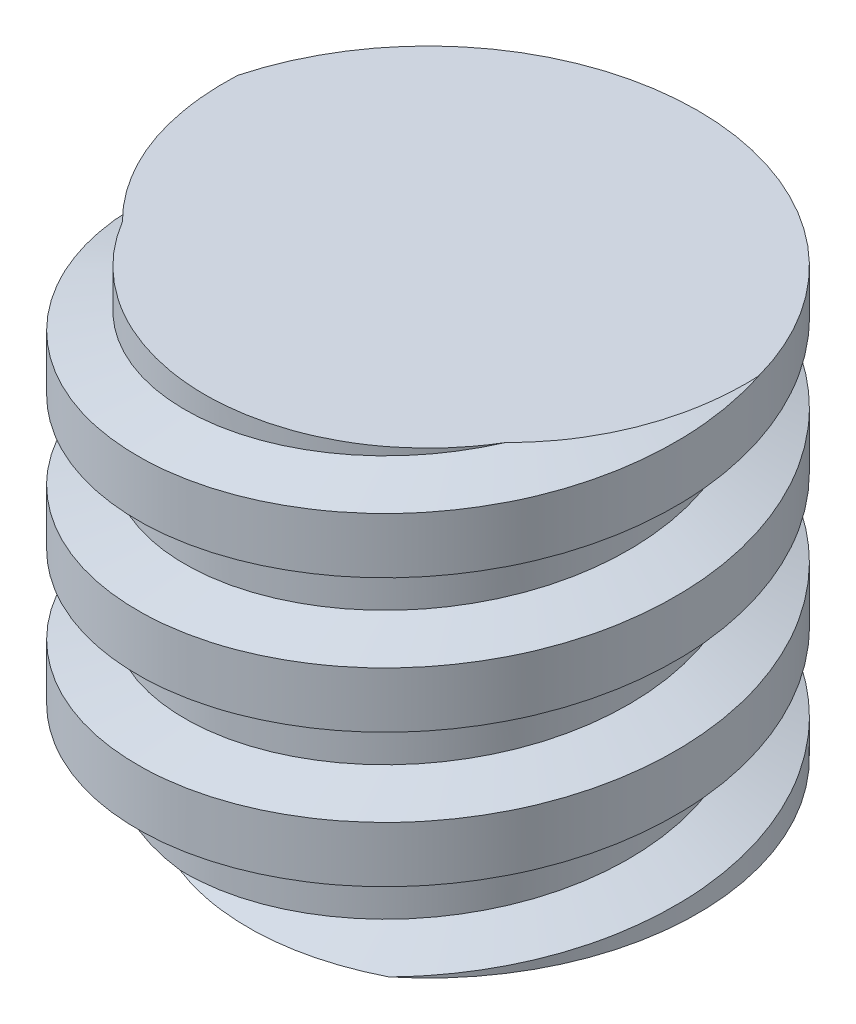
from build123d import *

# Parameters (mm, degrees)
SKETCH_3_W    = 9.5
SKETCH_3_H    = 15
SWEEP_1_PITCH = 4.712


with BuildPart() as part:
    # Эскиз3 → Повернуть1 (revolve)
    with BuildSketch(Plane.XY, mode=Mode.PRIVATE) as revolve_1_sk:
        with Locations((4.75, 7.5)):
            Rectangle(SKETCH_3_W, SKETCH_3_H)
    revolve(revolve_1_sk.sketch.rotate(Axis((0, 0, 0), (0, 1, 0)), 90), axis=Axis((0, 0, 0), (0, 1, 0)))

    # Вырез-По траектории1: arcs per turn and ends read off the stored shape
    # Вырез-По траектории1: the profile of Эскиз7 screwed along a right-hand helix through 8.75 turns, 12 arcs to a turn; built about Z, then put on its axis
    sweep_1_z = Axis((0, 0, 0), (0, 0, 1))
    sweep_1_corners = [(7.85, 0, -3.937550887), (7.85, 0, -5.486449113), (11.15, 0, -6.687550887), (11.15, 0, -2.736449113)]
    with BuildLine(mode=Mode.PRIVATE) as sweep_1_profile:
        Line(sweep_1_corners[0], sweep_1_corners[1])
        Line(sweep_1_corners[1], sweep_1_corners[2])
        Line(sweep_1_corners[2], sweep_1_corners[3])
        Line(sweep_1_corners[3], sweep_1_corners[0])
    sweep_1_cap = Face(sweep_1_profile.wire())
    sweep_1_turn_angles = [0, 15, 30, 45, 60, 75, 90, 105, 120, 135, 150, 165, 180, 195, 210, 225, 240, 255, 270, 285, 300, 315, 330, 345, 360]
    sweep_1_turn_weights = [1, 0.9659258262890683, 1, 0.9659258262890683, 1, 0.9659258262890683, 1, 0.9659258262890683, 1, 0.9659258262890683, 1, 0.9659258262890683, 1, 0.9659258262890683, 1, 0.9659258262890683, 1, 0.9659258262890683, 1, 0.9659258262890683, 1, 0.9659258262890683, 1, 0.9659258262890683, 1]
    sweep_1_turn_rails = [Edge.make_bspline([Vector(p[0], p[1], 0).rotate(sweep_1_z, sweep_1_turn_angles[k]) / sweep_1_turn_weights[k] + Vector(0, 0, p[2] + SWEEP_1_PITCH * sweep_1_turn_angles[k] / 360) for k in range(25)], [0, 0, 0, 1, 1, 2, 2, 3, 3, 4, 4, 5, 5, 6, 6, 7, 7, 8, 8, 9, 9, 10, 10, 11, 11, 12, 12, 12], 2, sweep_1_turn_weights) for p in sweep_1_corners]
    sweep_1_turn_sides = [Face.make_surface_from_curves(sweep_1_turn_rails[p[0]], sweep_1_turn_rails[p[1]]) for p in [(0, 1), (1, 2), (2, 3), (3, 0)]]
    sweep_1_last_angles = [2880, 2895, 2910, 2925, 2940, 2955, 2970, 2985, 3000, 3015, 3030, 3045, 3060, 3075, 3090, 3105, 3120, 3135, 3150]
    sweep_1_last_weights = [1, 0.9659258262890683, 1, 0.9659258262890683, 1, 0.9659258262890683, 1, 0.9659258262890683, 1, 0.9659258262890683, 1, 0.9659258262890683, 1, 0.9659258262890683, 1, 0.9659258262890683, 1, 0.9659258262890683, 1]
    sweep_1_last_rails = [Edge.make_bspline([Vector(p[0], p[1], 0).rotate(sweep_1_z, sweep_1_last_angles[k]) / sweep_1_last_weights[k] + Vector(0, 0, p[2] + SWEEP_1_PITCH * sweep_1_last_angles[k] / 360) for k in range(19)], [0, 0, 0, 1, 1, 2, 2, 3, 3, 4, 4, 5, 5, 6, 6, 7, 7, 8, 8, 9, 9, 9], 2, sweep_1_last_weights) for p in sweep_1_corners]
    sweep_1_last_sides = [Face.make_surface_from_curves(sweep_1_last_rails[p[0]], sweep_1_last_rails[p[1]]) for p in [(0, 1), (1, 2), (2, 3), (3, 0)]]
    sweep_1 = Plane(origin=(0, 15, 0), x_dir=(0, 0, 1), z_dir=(0, -1, 0)) * Solid(Shell([*[p.moved(Location((0, 0, SWEEP_1_PITCH * i))) for i in range(8) for p in sweep_1_turn_sides], *sweep_1_last_sides, sweep_1_cap, sweep_1_cap.rotate(sweep_1_z, 3150).moved(Location((0, 0, SWEEP_1_PITCH * 3150 / 360)))]))
    add(sweep_1, mode=Mode.SUBTRACT)


solid = part.part
